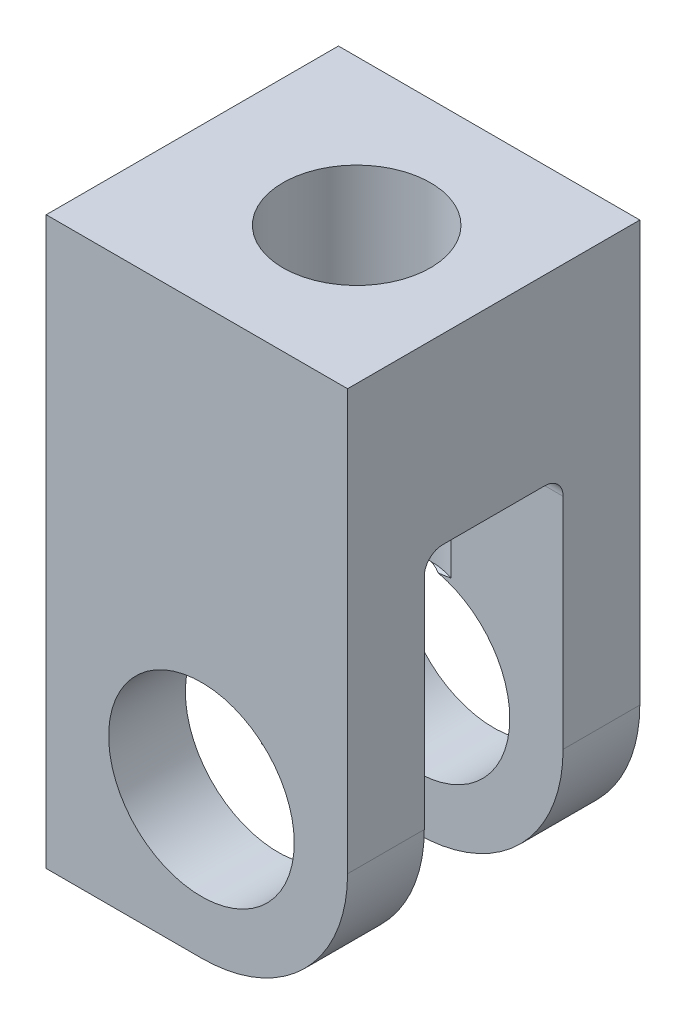
from build123d import *

# Parameters (mm, degrees)
BOSS_EXTRUDE1_DEPTH      = 4
BOSS_EXTRUDE1_DEPTH_BACK = 4
SKETCH1_W                = 9.25
SKETCH1_H                = 17
CUT_EXTRUDE1_DEPTH       = 1.9
CUT_EXTRUDE1_DEPTH_BACK  = 1.9
SKETCH2_W                = 9.25
SKETCH2_H                = 12
SKETCH3_R                = 2.54
CUT_EXTRUDE2_DEPTH       = 21.941883869
FILLET1_R                = 0.5
CUT_EXTRUDE5_DEPTH       = 21.941884033
CUT_EXTRUDE6_REACH       = 20.488
SKETCH9_W                = 1.000000032
SKETCH9_H                = 8


# Read off the part's stored shape, not the designer's step: #10-32 Tapped Hole1
with BuildPart() as part:
    # Sketch1 → Boss-Extrude1 (new, two sides: drawn at the far end of the back side and taken through both)
    with BuildSketch(Plane.XY.offset(-BOSS_EXTRUDE1_DEPTH_BACK)):
        with Locations((4.625, 8.5)):
            Rectangle(SKETCH1_W, SKETCH1_H)
    extrude(amount=BOSS_EXTRUDE1_DEPTH + BOSS_EXTRUDE1_DEPTH_BACK)

    # Sketch2 → Cut-Extrude1 (cut, two sides: drawn at the far end of the back side and taken through both)
    with BuildSketch(Plane.XY.offset(-CUT_EXTRUDE1_DEPTH_BACK)):
        with Locations((4.625, 6)):
            Rectangle(SKETCH2_W, SKETCH2_H)
    extrude(amount=CUT_EXTRUDE1_DEPTH + CUT_EXTRUDE1_DEPTH_BACK, mode=Mode.SUBTRACT)

    # Sketch3 → Cut-Extrude2 (cut, through all)
    with BuildSketch(Plane.XY.offset(4)):
        with Locations((5.25, 5.5)):
            Circle(SKETCH3_R)
    extrude(amount=-CUT_EXTRUDE2_DEPTH, mode=Mode.SUBTRACT)

    # #10-32 Tapped Hole1 outline → #10-32 Tapped Hole1 (revolve, cut)
    with BuildSketch(Plane(origin=(5.5, 0, 0), x_dir=(1, 0, 0), z_dir=(0, 0, 1))):
        Polygon((0, 7.973018958), (1.928351252, 7.973018958), (2.019302964, 8.027668689), (2.0193, 17), (0, 17), align=None)
    revolve(axis=Axis((5.5, 0, 0), (0, 1, 0)), mode=Mode.SUBTRACT)

    # Fillet1
    fillet1_edges = [part.edges().sort_by_distance(p)[0] for p in [
        (7.716900739, 12, -1.9),
        (7.716900739, 12, 1.9),
        (2.408099261, 12, -1.9),
        (2.408099261, 12, 1.9),
    ]]
    fillet(fillet1_edges, radius=FILLET1_R)

    # Sketch7 → Cut-Extrude5 (cut, through all)
    with BuildSketch(Plane.XY.offset(4)):
        with BuildLine():
            Line((5.25, 1.5), (0, 1.5))
            Line((0, 1.5), (0, 0))
            Line((0, 0), (9.25, 0))
            Line((9.25, 0), (9.25, 5.5))
            ThreePointArc((9.25, 5.5), (8.078427125, 2.671572875), (5.25, 1.5))
        make_face()
    extrude(amount=-CUT_EXTRUDE5_DEPTH, mode=Mode.SUBTRACT)

    # Sketch9 → Cut-Extrude6 (cut, up to next)
    with BuildSketch(Plane(origin=(0, 17, 0), x_dir=(1, 0, 0), z_dir=(0, 1, 0)), mode=Mode.PRIVATE) as cut_extrude6_sk1:
        with Locations((0.500000016, 0)):
            Rectangle(SKETCH9_W, SKETCH9_H)
    cut_extrude6_tool1 = extrude(cut_extrude6_sk1.sketch, amount=-CUT_EXTRUDE6_REACH, mode=Mode.PRIVATE) & part.part
    add(cut_extrude6_tool1.solids().sort_by_distance((0.5, 17, 0))[0], mode=Mode.SUBTRACT)


solid = part.part
